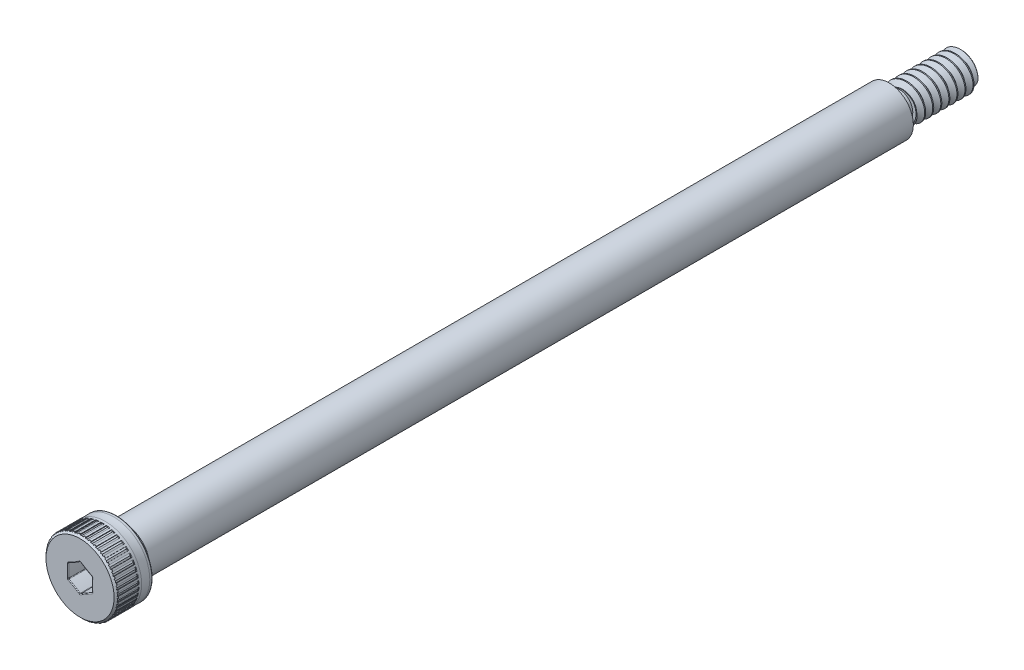
from build123d import *

# Parameters (mm, degrees)
SKETCH4_W             = 1.190625
SKETCH4_H             = 0.3175
SKETCH4_W_2           = 1.375833333
SKETCH4_H_2           = 0.687407664
CHAMFER1_SIZE         = 0.3175
FILLET1_R             = 0.1905
FILLET2_R             = 0.211666667
CHAMFER2_SIZE         = 0.264583333
CHAMFER3_SIZE         = 0.28575
CUT_EXTRUDE1_DEPTH    = 2.413
FILLET4_R             = 0.09525
DELETEFACE1_START     = -102.975833333
DELETEFACE1_OUTLINE_W = 6
DELETEFACE1_OUTLINE_H = 6
DELETEFACE1_OUTLINE_R = 1.725592336
DELETEFACE1_DEPTH     = 0.211666766
CUT_SWEEP1_PITCH      = 1.058333333
CUT_EXTRUDE2_REACH    = 118.083
CIRPATTERN1_COUNT     = 42
FILLET5_R             = 0.0508


# Read off the part's stored shape, not the designer's step: DeleteFace1, CirPattern2
with BuildPart() as part:
    # Sketch3 → Revolve1 (revolve)
    with BuildSketch(Plane(origin=(0, 0, 0), x_dir=(0, 0, -1), z_dir=(1, 0, 0)), mode=Mode.PRIVATE) as revolve1_sk:
        Polygon((-4.7625, 4.7625), (0, 4.7625), (0, 3.175), (101.6, 3.175), (101.6, 2.413), (111.125, 2.413), (111.125, 0), (-4.7625, 0), align=None)
    revolve(revolve1_sk.sketch.rotate(Axis((0, 0, 4.7625), (0, 0, -1)), 90), axis=Axis((0, 0, 4.7625), (0, 0, -1)))

    # Sketch4 → Cut-Revolve1 (revolve, cut)
    with BuildSketch(Plane(origin=(0, 0, 0), x_dir=(0, 0, -1), z_dir=(1, 0, 0)), mode=Mode.PRIVATE) as cut_revolve1_sk:
        with Locations((0.5953125, 3.01625)):
            Rectangle(SKETCH4_W, SKETCH4_H)
        with Locations((102.287916667, 2.069296168)):
            Rectangle(SKETCH4_W_2, SKETCH4_H_2)
    revolve(cut_revolve1_sk.sketch.rotate(Axis((0, 0, 4.7625), (0, 0, -1)), 90), axis=Axis((0, 0, 4.7625), (0, 0, -1)), mode=Mode.SUBTRACT)

    # Chamfer1
    chamfer1_edges = [part.edges().sort_by_distance(p)[0] for p in [
        (-2.8575, 0, -1.190625),
    ]]
    chamfer(chamfer1_edges, length=CHAMFER1_SIZE - 0.0001)  # a hair under: the kernel refuses the full size

    # Fillet1
    fillet1_edges = [part.edges().sort_by_distance(p)[0] for p in [
        (-2.8575, 0, 0),
    ]]
    fillet(fillet1_edges, radius=FILLET1_R)

    # Fillet2
    fillet2_edges = [part.edges().sort_by_distance(p)[0] for p in [
        (-1.725592336, 0, -101.6),
        (-1.725592336, 0, -102.975833333),
    ]]
    fillet(fillet2_edges, radius=FILLET2_R)

    # Chamfer2
    chamfer2_edges = [part.edges().sort_by_distance(p)[0] for p in [
        (-2.413, 0, -102.975833333),
        (-2.413, 0, -111.125),
    ]]
    chamfer(chamfer2_edges, length=CHAMFER2_SIZE)

    # Chamfer3
    chamfer3_edges = [part.edges().sort_by_distance(p)[0] for p in [
        (-4.7625, 0, 4.7625),
    ]]
    chamfer(chamfer3_edges, length=CHAMFER3_SIZE)

    # Sketch5 → Cut-Extrude1 (cut)
    with BuildSketch(Plane.XY.offset(4.7625)):
        with BuildLine():
            ThreePointArc((1.5875, 0.916543552), (0.777875, 1.347319022), (0, 1.833087105))
            ThreePointArc((0, 1.833087105), (-0.777875, 1.347319022), (-1.5875, 0.916543552))
            ThreePointArc((-1.5875, 0.916543552), (-1.55575, 0), (-1.5875, -0.916543552))
            ThreePointArc((-1.5875, -0.916543552), (-0.777875, -1.347319022), (0, -1.833087105))
            ThreePointArc((0, -1.833087105), (0.777875, -1.347319022), (1.5875, -0.916543552))
            ThreePointArc((1.5875, -0.916543552), (1.55575, 0), (1.5875, 0.916543552))
        make_face()
    extrude(amount=-CUT_EXTRUDE1_DEPTH, mode=Mode.SUBTRACT)

    # Fillet4
    fillet4_edges = [part.edges().sort_by_distance(p)[0] for p in [
        (1.55575, 0, 2.3495),
        (1.5875, 0.916543552, 3.556),
        (0.777875, -1.347319022, 2.3495),
        (1.5875, -0.916543552, 3.556),
        (-0.777875, -1.347319022, 2.3495),
        (0, -1.833087105, 3.556),
        (-1.55575, 0, 2.3495),
        (-1.5875, -0.916543552, 3.556),
        (-0.777875, 1.347319022, 2.3495),
        (-1.5875, 0.916543552, 3.556),
        (0.777875, 1.347319022, 2.3495),
        (0, 1.833087105, 3.556),
        (1.55575, 0, 4.7625),
        (0.777875, 1.347319022, 4.7625),
        (-0.777875, 1.347319022, 4.7625),
        (-1.55575, 0, 4.7625),
        (-0.777875, -1.347319022, 4.7625),
        (0.777875, -1.347319022, 4.7625),
        (-4.7625, 0, 0),
    ]]
    fillet(fillet4_edges, radius=FILLET4_R)

    # DeleteFace1 outline → DeleteFace1 (cut)
    with BuildSketch(Plane.XY.offset(DELETEFACE1_START)):
        Rectangle(DELETEFACE1_OUTLINE_W, DELETEFACE1_OUTLINE_H)
        Circle(DELETEFACE1_OUTLINE_R, mode=Mode.SUBTRACT)
    extrude(amount=DELETEFACE1_DEPTH, mode=Mode.SUBTRACT)

    # Cut-Sweep1: the profile of Sketch7 profile screwed along a right-hand helix of 8.48 turns, 8 arcs to a turn; built about Z, then put on its axis
    cut_sweep1_z = Axis((0, 0, 0), (0, 0, 1))
    cut_sweep1_corners = [(2.470283972, 0, 0.033072917), (2.470283972, 0, -0.959114583), (1.725292336, 0, -0.528993462), (1.725292336, 0, -0.397048205)]
    with BuildLine(mode=Mode.PRIVATE) as cut_sweep1_profile:
        Line(cut_sweep1_corners[0], cut_sweep1_corners[1])
        Line(cut_sweep1_corners[1], cut_sweep1_corners[2])
        Line(cut_sweep1_corners[2], cut_sweep1_corners[3])
        Line(cut_sweep1_corners[3], cut_sweep1_corners[0])
    cut_sweep1_cap = Face(cut_sweep1_profile.wire())
    cut_sweep1_turn_angles = [0, 22.5, 45, 67.5, 90, 112.5, 135, 157.5, 180, 202.5, 225, 247.5, 270, 292.5, 315, 337.5, 360]
    cut_sweep1_turn_weights = [1, 0.9238795325112867, 1, 0.9238795325112867, 1, 0.9238795325112867, 1, 0.9238795325112867, 1, 0.9238795325112867, 1, 0.9238795325112867, 1, 0.9238795325112867, 1, 0.9238795325112867, 1]
    cut_sweep1_turn_rails = [Edge.make_bspline([Vector(p[0], p[1], 0).rotate(cut_sweep1_z, cut_sweep1_turn_angles[k]) / cut_sweep1_turn_weights[k] + Vector(0, 0, p[2] + CUT_SWEEP1_PITCH * cut_sweep1_turn_angles[k] / 360) for k in range(17)], [0, 0, 0, 1, 1, 2, 2, 3, 3, 4, 4, 5, 5, 6, 6, 7, 7, 8, 8, 8], 2, cut_sweep1_turn_weights) for p in cut_sweep1_corners]
    cut_sweep1_turn_sides = [Face.make_surface_from_curves(cut_sweep1_turn_rails[p[0]], cut_sweep1_turn_rails[p[1]]) for p in [(0, 1), (1, 2), (2, 3), (3, 0)]]
    cut_sweep1_last_angles = [2880, 2902.5, 2925, 2947.5, 2970, 2992.5, 3015, 3033.9, 3052.8]
    cut_sweep1_last_weights = [1, 0.9238795325112867, 1, 0.9238795325112867, 1, 0.9238795325112867, 1, 0.9460853588275885, 1]
    cut_sweep1_last_rails = [Edge.make_bspline([Vector(p[0], p[1], 0).rotate(cut_sweep1_z, cut_sweep1_last_angles[k]) / cut_sweep1_last_weights[k] + Vector(0, 0, p[2] + CUT_SWEEP1_PITCH * cut_sweep1_last_angles[k] / 360) for k in range(9)], [0, 0, 0, 1, 1, 2, 2, 3, 3, 4, 4, 4], 2, cut_sweep1_last_weights) for p in cut_sweep1_corners]
    cut_sweep1_last_sides = [Face.make_surface_from_curves(cut_sweep1_last_rails[p[0]], cut_sweep1_last_rails[p[1]]) for p in [(0, 1), (1, 2), (2, 3), (3, 0)]]
    cut_sweep1 = Plane(origin=(0, 0, -111.125), x_dir=(0, 1, 0), z_dir=(0, 0, 1)) * Solid(Shell([*[p.moved(Location((0, 0, CUT_SWEEP1_PITCH * i))) for i in range(8) for p in cut_sweep1_turn_sides], *cut_sweep1_last_sides, cut_sweep1_cap, cut_sweep1_cap.rotate(cut_sweep1_z, 3052.8).moved(Location((0, 0, CUT_SWEEP1_PITCH * 3052.8 / 360)))]))
    add(cut_sweep1, mode=Mode.SUBTRACT)

    # Cut-Extrude2: up to this plane
    cut_extrude2_end = Plane(origin=(0, 5.814873764, 0.733563736), z_dir=(0, 0.707106781186546, 0.7071067811865491))
    # Sketch8 → Cut-Extrude2 (cut, up to the surface)
    with BuildSketch(Plane.XY.offset(4.7625), mode=Mode.PRIVATE) as cut_extrude2_sk1:
        Polygon((-0.2286, 4.7625), (0.2286, 4.7625), (0.218989269, 4.67106), (0, 4.71678), (-0.218989269, 4.67106), align=None)
    cut_extrude2_tool1 = split(extrude(cut_extrude2_sk1.sketch, amount=-CUT_EXTRUDE2_REACH, mode=Mode.PRIVATE), bisect_by=cut_extrude2_end, keep=Keep.BOTH, mode=Mode.PRIVATE)
    cut_extrude2 = cut_extrude2_tool1.solids().sort_by_distance((0, 4.727084, 4.7625))[0]
    add(cut_extrude2, mode=Mode.SUBTRACT)

    # CirPattern1: Cut-Extrude2 ×42 about axis
    cirpattern1_axis = Axis((0, 0, 0), (0, 0, 1))
    for i in range(1, CIRPATTERN1_COUNT):
        add(cut_extrude2.rotate(cirpattern1_axis, i * 360 / CIRPATTERN1_COUNT), mode=Mode.SUBTRACT)

    # Fillet5
    fillet5_edges = [part.edges().sort_by_distance(p)[0] for p in [
        (0.355902071, 4.749183084, 4.47675),
    ]]
    fillet(fillet5_edges, radius=FILLET5_R)

    # CirPattern2 outline → CirPattern2 (revolve, cut)
    with BuildSketch(Plane.XZ):
        with BuildLine():
            ThreePointArc((4.747621024, 4.491628976), (4.75863308, 4.47514827), (4.7625, 4.455707951))
            Line((4.7625, 4.455707951), (4.7625, 4.491628976))
            Line((4.7625, 4.491628976), (4.747621024, 4.491628976))
        make_face()
    revolve(axis=Axis((0, 0, 0), (0, 0, 1)), mode=Mode.SUBTRACT)

    # Sketch11 → Cut-Revolve6 (revolve, cut)
    with BuildSketch(Plane(origin=(0, 0, 0), x_dir=(0, 0, -1), z_dir=(1, 0, 0)), mode=Mode.PRIVATE) as cut_revolve6_sk:
        with BuildLine():
            Line((-1.42875, 4.7625), (-0.3571875, 4.7625))
            ThreePointArc((-0.3571875, 4.7625), (-0.89296875, 4.74472), (-1.42875, 4.7625))
        make_face()
    revolve(cut_revolve6_sk.sketch.rotate(Axis((0, 0, 4.7625), (0, 0, -1)), 90), axis=Axis((0, 0, 4.7625), (0, 0, -1)), mode=Mode.SUBTRACT)


solid = part.part
